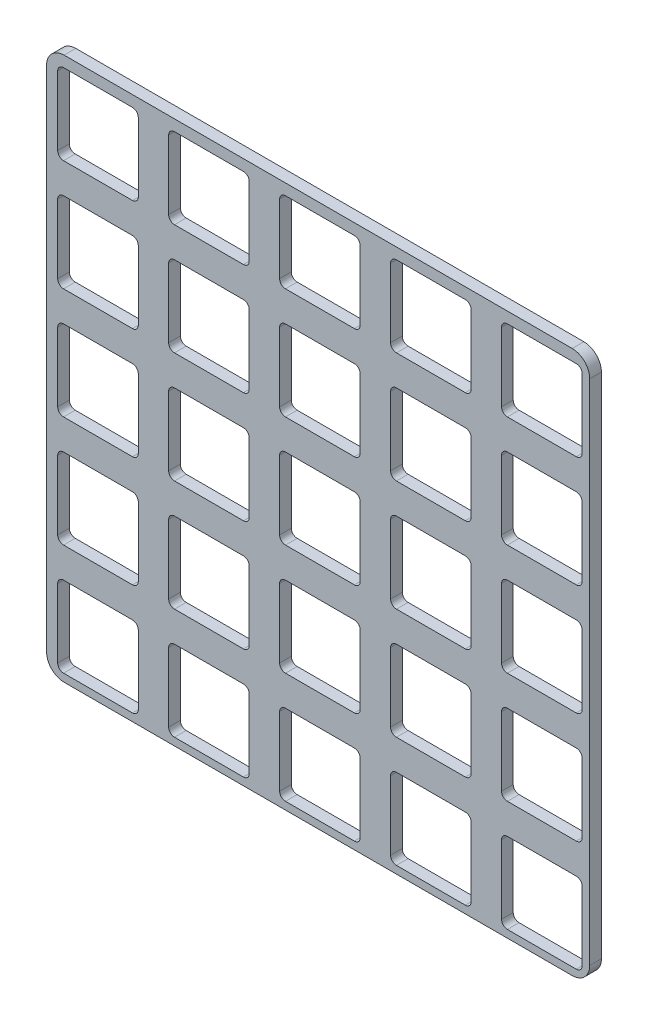
from build123d import *

# Parameters (mm, degrees)
BOSS_EXTRUDE1_DEPTH = 2


with BuildPart() as part:
    # Sketch2 → Boss-Extrude1 (new body)
    with BuildSketch(Plane.XY):
        with BuildLine():
            Line((-43.5, 46.5), (43.5, 46.5))
            ThreePointArc((43.5, 46.5), (45.621320344, 45.621320344), (46.5, 43.5))
            Line((46.5, 43.5), (46.5, -43.5))
            ThreePointArc((46.5, -43.5), (45.621320344, -45.621320344), (43.5, -46.5))
            Line((43.5, -46.5), (-43.5, -46.5))
            ThreePointArc((-43.5, -46.5), (-45.621320344, -45.621320344), (-46.5, -43.5))
            Line((-46.5, -43.5), (-46.5, 43.5))
            ThreePointArc((-46.5, 43.5), (-45.621320344, 45.621320344), (-43.5, 46.5))
        make_face()
        with BuildLine():
            Line((-25.6, 43.6), (-25.6, 31.8))
            ThreePointArc((-25.6, 31.8), (-25.307106781, 31.092893219), (-24.6, 30.8))
            Line((-24.6, 30.8), (-12.8, 30.8))
            ThreePointArc((-12.8, 30.8), (-12.092893219, 31.092893219), (-11.8, 31.8))
            Line((-11.8, 31.8), (-11.8, 43.6))
            ThreePointArc((-11.8, 43.6), (-12.092893219, 44.307106781), (-12.8, 44.6))
            Line((-12.8, 44.6), (-24.6, 44.6))
            ThreePointArc((-24.6, 44.6), (-25.307106781, 44.307106781), (-25.6, 43.6))
        make_face(mode=Mode.SUBTRACT)
        with BuildLine():
            Line((-43.6, 44.6), (-31.8, 44.6))
            ThreePointArc((-31.8, 44.6), (-31.092893219, 44.307106781), (-30.8, 43.6))
            Line((-30.8, 43.6), (-30.8, 31.8))
            ThreePointArc((-30.8, 31.8), (-31.092893219, 31.092893219), (-31.8, 30.8))
            Line((-31.8, 30.8), (-43.6, 30.8))
            ThreePointArc((-43.6, 30.8), (-44.307106781, 31.092893219), (-44.6, 31.8))
            Line((-44.6, 31.8), (-44.6, 43.6))
            ThreePointArc((-44.6, 43.6), (-44.307106781, 44.307106781), (-43.6, 44.6))
        make_face(mode=Mode.SUBTRACT)
        with BuildLine():
            Line((-6.6, 43.6), (-6.6, 31.8))
            ThreePointArc((-6.6, 31.8), (-6.307106781, 31.092893219), (-5.6, 30.8))
            Line((-5.6, 30.8), (6.2, 30.8))
            ThreePointArc((6.2, 30.8), (6.907106781, 31.092893219), (7.2, 31.8))
            Line((7.2, 31.8), (7.2, 43.6))
            ThreePointArc((7.2, 43.6), (6.907106781, 44.307106781), (6.2, 44.6))
            Line((6.2, 44.6), (-5.6, 44.6))
            ThreePointArc((-5.6, 44.6), (-6.307106781, 44.307106781), (-6.6, 43.6))
        make_face(mode=Mode.SUBTRACT)
        with BuildLine():
            Line((12.4, 43.6), (12.4, 31.8))
            ThreePointArc((12.4, 31.8), (12.692893219, 31.092893219), (13.4, 30.8))
            Line((13.4, 30.8), (25.2, 30.8))
            ThreePointArc((25.2, 30.8), (25.907106781, 31.092893219), (26.2, 31.8))
            Line((26.2, 31.8), (26.2, 43.6))
            ThreePointArc((26.2, 43.6), (25.907106781, 44.307106781), (25.2, 44.6))
            Line((25.2, 44.6), (13.4, 44.6))
            ThreePointArc((13.4, 44.6), (12.692893219, 44.307106781), (12.4, 43.6))
        make_face(mode=Mode.SUBTRACT)
        with BuildLine():
            Line((31.4, 43.6), (31.4, 31.8))
            ThreePointArc((31.4, 31.8), (31.692893219, 31.092893219), (32.4, 30.8))
            Line((32.4, 30.8), (44.2, 30.8))
            ThreePointArc((44.2, 30.8), (44.907106781, 31.092893219), (45.2, 31.8))
            Line((45.2, 31.8), (45.2, 43.6))
            ThreePointArc((45.2, 43.6), (44.907106781, 44.307106781), (44.2, 44.6))
            Line((44.2, 44.6), (32.4, 44.6))
            ThreePointArc((32.4, 44.6), (31.692893219, 44.307106781), (31.4, 43.6))
        make_face(mode=Mode.SUBTRACT)
        with BuildLine():
            Line((-25.6, 24.6), (-25.6, 12.8))
            ThreePointArc((-25.6, 12.8), (-25.307106781, 12.092893219), (-24.6, 11.8))
            Line((-24.6, 11.8), (-12.8, 11.8))
            ThreePointArc((-12.8, 11.8), (-12.092893219, 12.092893219), (-11.8, 12.8))
            Line((-11.8, 12.8), (-11.8, 24.6))
            ThreePointArc((-11.8, 24.6), (-12.092893219, 25.307106781), (-12.8, 25.6))
            Line((-12.8, 25.6), (-24.6, 25.6))
            ThreePointArc((-24.6, 25.6), (-25.307106781, 25.307106781), (-25.6, 24.6))
        make_face(mode=Mode.SUBTRACT)
        with BuildLine():
            Line((-6.6, 24.6), (-6.6, 12.8))
            ThreePointArc((-6.6, 12.8), (-6.307106781, 12.092893219), (-5.6, 11.8))
            Line((-5.6, 11.8), (6.2, 11.8))
            ThreePointArc((6.2, 11.8), (6.907106781, 12.092893219), (7.2, 12.8))
            Line((7.2, 12.8), (7.2, 24.6))
            ThreePointArc((7.2, 24.6), (6.907106781, 25.307106781), (6.2, 25.6))
            Line((6.2, 25.6), (-5.6, 25.6))
            ThreePointArc((-5.6, 25.6), (-6.307106781, 25.307106781), (-6.6, 24.6))
        make_face(mode=Mode.SUBTRACT)
        with BuildLine():
            Line((12.4, 24.6), (12.4, 12.8))
            ThreePointArc((12.4, 12.8), (12.692893219, 12.092893219), (13.4, 11.8))
            Line((13.4, 11.8), (25.2, 11.8))
            ThreePointArc((25.2, 11.8), (25.907106781, 12.092893219), (26.2, 12.8))
            Line((26.2, 12.8), (26.2, 24.6))
            ThreePointArc((26.2, 24.6), (25.907106781, 25.307106781), (25.2, 25.6))
            Line((25.2, 25.6), (13.4, 25.6))
            ThreePointArc((13.4, 25.6), (12.692893219, 25.307106781), (12.4, 24.6))
        make_face(mode=Mode.SUBTRACT)
        with BuildLine():
            Line((31.4, 24.6), (31.4, 12.8))
            ThreePointArc((31.4, 12.8), (31.692893219, 12.092893219), (32.4, 11.8))
            Line((32.4, 11.8), (44.2, 11.8))
            ThreePointArc((44.2, 11.8), (44.907106781, 12.092893219), (45.2, 12.8))
            Line((45.2, 12.8), (45.2, 24.6))
            ThreePointArc((45.2, 24.6), (44.907106781, 25.307106781), (44.2, 25.6))
            Line((44.2, 25.6), (32.4, 25.6))
            ThreePointArc((32.4, 25.6), (31.692893219, 25.307106781), (31.4, 24.6))
        make_face(mode=Mode.SUBTRACT)
        with BuildLine():
            Line((-25.6, 5.6), (-25.6, -6.2))
            ThreePointArc((-25.6, -6.2), (-25.307106781, -6.907106781), (-24.6, -7.2))
            Line((-24.6, -7.2), (-12.8, -7.2))
            ThreePointArc((-12.8, -7.2), (-12.092893219, -6.907106781), (-11.8, -6.2))
            Line((-11.8, -6.2), (-11.8, 5.6))
            ThreePointArc((-11.8, 5.6), (-12.092893219, 6.307106781), (-12.8, 6.6))
            Line((-12.8, 6.6), (-24.6, 6.6))
            ThreePointArc((-24.6, 6.6), (-25.307106781, 6.307106781), (-25.6, 5.6))
        make_face(mode=Mode.SUBTRACT)
        with BuildLine():
            Line((-6.6, 5.6), (-6.6, -6.2))
            ThreePointArc((-6.6, -6.2), (-6.307106781, -6.907106781), (-5.6, -7.2))
            Line((-5.6, -7.2), (6.2, -7.2))
            ThreePointArc((6.2, -7.2), (6.907106781, -6.907106781), (7.2, -6.2))
            Line((7.2, -6.2), (7.2, 5.6))
            ThreePointArc((7.2, 5.6), (6.907106781, 6.307106781), (6.2, 6.6))
            Line((6.2, 6.6), (-5.6, 6.6))
            ThreePointArc((-5.6, 6.6), (-6.307106781, 6.307106781), (-6.6, 5.6))
        make_face(mode=Mode.SUBTRACT)
        with BuildLine():
            Line((12.4, 5.6), (12.4, -6.2))
            ThreePointArc((12.4, -6.2), (12.692893219, -6.907106781), (13.4, -7.2))
            Line((13.4, -7.2), (25.2, -7.2))
            ThreePointArc((25.2, -7.2), (25.907106781, -6.907106781), (26.2, -6.2))
            Line((26.2, -6.2), (26.2, 5.6))
            ThreePointArc((26.2, 5.6), (25.907106781, 6.307106781), (25.2, 6.6))
            Line((25.2, 6.6), (13.4, 6.6))
            ThreePointArc((13.4, 6.6), (12.692893219, 6.307106781), (12.4, 5.6))
        make_face(mode=Mode.SUBTRACT)
        with BuildLine():
            Line((31.4, 5.6), (31.4, -6.2))
            ThreePointArc((31.4, -6.2), (31.692893219, -6.907106781), (32.4, -7.2))
            Line((32.4, -7.2), (44.2, -7.2))
            ThreePointArc((44.2, -7.2), (44.907106781, -6.907106781), (45.2, -6.2))
            Line((45.2, -6.2), (45.2, 5.6))
            ThreePointArc((45.2, 5.6), (44.907106781, 6.307106781), (44.2, 6.6))
            Line((44.2, 6.6), (32.4, 6.6))
            ThreePointArc((32.4, 6.6), (31.692893219, 6.307106781), (31.4, 5.6))
        make_face(mode=Mode.SUBTRACT)
        with BuildLine():
            Line((-25.6, -13.4), (-25.6, -25.2))
            ThreePointArc((-25.6, -25.2), (-25.307106781, -25.907106781), (-24.6, -26.2))
            Line((-24.6, -26.2), (-12.8, -26.2))
            ThreePointArc((-12.8, -26.2), (-12.092893219, -25.907106781), (-11.8, -25.2))
            Line((-11.8, -25.2), (-11.8, -13.4))
            ThreePointArc((-11.8, -13.4), (-12.092893219, -12.692893219), (-12.8, -12.4))
            Line((-12.8, -12.4), (-24.6, -12.4))
            ThreePointArc((-24.6, -12.4), (-25.307106781, -12.692893219), (-25.6, -13.4))
        make_face(mode=Mode.SUBTRACT)
        with BuildLine():
            Line((-6.6, -13.4), (-6.6, -25.2))
            ThreePointArc((-6.6, -25.2), (-6.307106781, -25.907106781), (-5.6, -26.2))
            Line((-5.6, -26.2), (6.2, -26.2))
            ThreePointArc((6.2, -26.2), (6.907106781, -25.907106781), (7.2, -25.2))
            Line((7.2, -25.2), (7.2, -13.4))
            ThreePointArc((7.2, -13.4), (6.907106781, -12.692893219), (6.2, -12.4))
            Line((6.2, -12.4), (-5.6, -12.4))
            ThreePointArc((-5.6, -12.4), (-6.307106781, -12.692893219), (-6.6, -13.4))
        make_face(mode=Mode.SUBTRACT)
        with BuildLine():
            Line((12.4, -13.4), (12.4, -25.2))
            ThreePointArc((12.4, -25.2), (12.692893219, -25.907106781), (13.4, -26.2))
            Line((13.4, -26.2), (25.2, -26.2))
            ThreePointArc((25.2, -26.2), (25.907106781, -25.907106781), (26.2, -25.2))
            Line((26.2, -25.2), (26.2, -13.4))
            ThreePointArc((26.2, -13.4), (25.907106781, -12.692893219), (25.2, -12.4))
            Line((25.2, -12.4), (13.4, -12.4))
            ThreePointArc((13.4, -12.4), (12.692893219, -12.692893219), (12.4, -13.4))
        make_face(mode=Mode.SUBTRACT)
        with BuildLine():
            Line((31.4, -13.4), (31.4, -25.2))
            ThreePointArc((31.4, -25.2), (31.692893219, -25.907106781), (32.4, -26.2))
            Line((32.4, -26.2), (44.2, -26.2))
            ThreePointArc((44.2, -26.2), (44.907106781, -25.907106781), (45.2, -25.2))
            Line((45.2, -25.2), (45.2, -13.4))
            ThreePointArc((45.2, -13.4), (44.907106781, -12.692893219), (44.2, -12.4))
            Line((44.2, -12.4), (32.4, -12.4))
            ThreePointArc((32.4, -12.4), (31.692893219, -12.692893219), (31.4, -13.4))
        make_face(mode=Mode.SUBTRACT)
        with BuildLine():
            Line((-25.6, -32.4), (-25.6, -44.2))
            ThreePointArc((-25.6, -44.2), (-25.307106781, -44.907106781), (-24.6, -45.2))
            Line((-24.6, -45.2), (-12.8, -45.2))
            ThreePointArc((-12.8, -45.2), (-12.092893219, -44.907106781), (-11.8, -44.2))
            Line((-11.8, -44.2), (-11.8, -32.4))
            ThreePointArc((-11.8, -32.4), (-12.092893219, -31.692893219), (-12.8, -31.4))
            Line((-12.8, -31.4), (-24.6, -31.4))
            ThreePointArc((-24.6, -31.4), (-25.307106781, -31.692893219), (-25.6, -32.4))
        make_face(mode=Mode.SUBTRACT)
        with BuildLine():
            Line((-6.6, -32.4), (-6.6, -44.2))
            ThreePointArc((-6.6, -44.2), (-6.307106781, -44.907106781), (-5.6, -45.2))
            Line((-5.6, -45.2), (6.2, -45.2))
            ThreePointArc((6.2, -45.2), (6.907106781, -44.907106781), (7.2, -44.2))
            Line((7.2, -44.2), (7.2, -32.4))
            ThreePointArc((7.2, -32.4), (6.907106781, -31.692893219), (6.2, -31.4))
            Line((6.2, -31.4), (-5.6, -31.4))
            ThreePointArc((-5.6, -31.4), (-6.307106781, -31.692893219), (-6.6, -32.4))
        make_face(mode=Mode.SUBTRACT)
        with BuildLine():
            Line((12.4, -32.4), (12.4, -44.2))
            ThreePointArc((12.4, -44.2), (12.692893219, -44.907106781), (13.4, -45.2))
            Line((13.4, -45.2), (25.2, -45.2))
            ThreePointArc((25.2, -45.2), (25.907106781, -44.907106781), (26.2, -44.2))
            Line((26.2, -44.2), (26.2, -32.4))
            ThreePointArc((26.2, -32.4), (25.907106781, -31.692893219), (25.2, -31.4))
            Line((25.2, -31.4), (13.4, -31.4))
            ThreePointArc((13.4, -31.4), (12.692893219, -31.692893219), (12.4, -32.4))
        make_face(mode=Mode.SUBTRACT)
        with BuildLine():
            Line((31.4, -32.4), (31.4, -44.2))
            ThreePointArc((31.4, -44.2), (31.692893219, -44.907106781), (32.4, -45.2))
            Line((32.4, -45.2), (44.2, -45.2))
            ThreePointArc((44.2, -45.2), (44.907106781, -44.907106781), (45.2, -44.2))
            Line((45.2, -44.2), (45.2, -32.4))
            ThreePointArc((45.2, -32.4), (44.907106781, -31.692893219), (44.2, -31.4))
            Line((44.2, -31.4), (32.4, -31.4))
            ThreePointArc((32.4, -31.4), (31.692893219, -31.692893219), (31.4, -32.4))
        make_face(mode=Mode.SUBTRACT)
        with BuildLine():
            Line((-44.6, 24.6), (-44.6, 12.8))
            ThreePointArc((-44.6, 12.8), (-44.307106781, 12.092893219), (-43.6, 11.8))
            Line((-43.6, 11.8), (-31.8, 11.8))
            ThreePointArc((-31.8, 11.8), (-31.092893219, 12.092893219), (-30.8, 12.8))
            Line((-30.8, 12.8), (-30.8, 24.6))
            ThreePointArc((-30.8, 24.6), (-31.092893219, 25.307106781), (-31.8, 25.6))
            Line((-31.8, 25.6), (-43.6, 25.6))
            ThreePointArc((-43.6, 25.6), (-44.307106781, 25.307106781), (-44.6, 24.6))
        make_face(mode=Mode.SUBTRACT)
        with BuildLine():
            Line((-44.6, 5.6), (-44.6, -6.2))
            ThreePointArc((-44.6, -6.2), (-44.307106781, -6.907106781), (-43.6, -7.2))
            Line((-43.6, -7.2), (-31.8, -7.2))
            ThreePointArc((-31.8, -7.2), (-31.092893219, -6.907106781), (-30.8, -6.2))
            Line((-30.8, -6.2), (-30.8, 5.6))
            ThreePointArc((-30.8, 5.6), (-31.092893219, 6.307106781), (-31.8, 6.6))
            Line((-31.8, 6.6), (-43.6, 6.6))
            ThreePointArc((-43.6, 6.6), (-44.307106781, 6.307106781), (-44.6, 5.6))
        make_face(mode=Mode.SUBTRACT)
        with BuildLine():
            Line((-44.6, -13.4), (-44.6, -25.2))
            ThreePointArc((-44.6, -25.2), (-44.307106781, -25.907106781), (-43.6, -26.2))
            Line((-43.6, -26.2), (-31.8, -26.2))
            ThreePointArc((-31.8, -26.2), (-31.092893219, -25.907106781), (-30.8, -25.2))
            Line((-30.8, -25.2), (-30.8, -13.4))
            ThreePointArc((-30.8, -13.4), (-31.092893219, -12.692893219), (-31.8, -12.4))
            Line((-31.8, -12.4), (-43.6, -12.4))
            ThreePointArc((-43.6, -12.4), (-44.307106781, -12.692893219), (-44.6, -13.4))
        make_face(mode=Mode.SUBTRACT)
        with BuildLine():
            Line((-44.6, -32.4), (-44.6, -44.2))
            ThreePointArc((-44.6, -44.2), (-44.307106781, -44.907106781), (-43.6, -45.2))
            Line((-43.6, -45.2), (-31.8, -45.2))
            ThreePointArc((-31.8, -45.2), (-31.092893219, -44.907106781), (-30.8, -44.2))
            Line((-30.8, -44.2), (-30.8, -32.4))
            ThreePointArc((-30.8, -32.4), (-31.092893219, -31.692893219), (-31.8, -31.4))
            Line((-31.8, -31.4), (-43.6, -31.4))
            ThreePointArc((-43.6, -31.4), (-44.307106781, -31.692893219), (-44.6, -32.4))
        make_face(mode=Mode.SUBTRACT)
    extrude(amount=BOSS_EXTRUDE1_DEPTH)


solid = part.part
